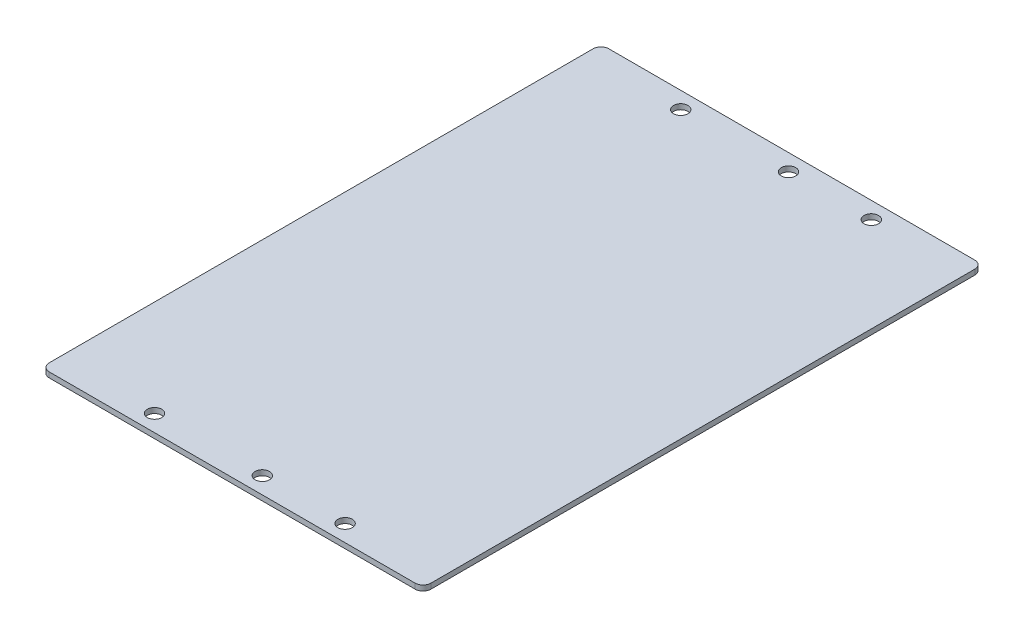
from build123d import *

# Parameters (mm, degrees)
SKETCH1_W           = 145.2
SKETCH1_H           = 212.895
SKETCH1_R           = 2.75
BOSS_EXTRUDE1_DEPTH = 2
FILLET1_R           = 3


with BuildPart() as part:
    # Sketch1 → Boss-Extrude1 (new body)
    with BuildSketch(Plane(origin=(0, 0, 0), x_dir=(1, 0, 0), z_dir=(0, 1, 0))):
        with Locations((78.3, 107.8525)):
            Rectangle(SKETCH1_W, SKETCH1_H)
        with Locations((42.4, 207.95)):
            Circle(SKETCH1_R, mode=Mode.SUBTRACT)
        with Locations((83.4, 207.95)):
            Circle(SKETCH1_R, mode=Mode.SUBTRACT)
        with Locations((114.9, 207.95)):
            Circle(SKETCH1_R, mode=Mode.SUBTRACT)
        with Locations((114.9, 7.755)):
            Circle(SKETCH1_R, mode=Mode.SUBTRACT)
        with Locations((83.4, 7.755)):
            Circle(SKETCH1_R, mode=Mode.SUBTRACT)
        with Locations((42.4, 7.755)):
            Circle(SKETCH1_R, mode=Mode.SUBTRACT)
    extrude(amount=BOSS_EXTRUDE1_DEPTH)

    # Fillet1
    fillet1_edges = [part.edges().sort_by_distance(p)[0] for p in [
        (5.7, 1, -214.3),
        (150.9, 1, -214.3),
        (150.9, 1, -1.405),
        (5.7, 1, -1.405),
    ]]
    fillet(fillet1_edges, radius=FILLET1_R)


solid = part.part
